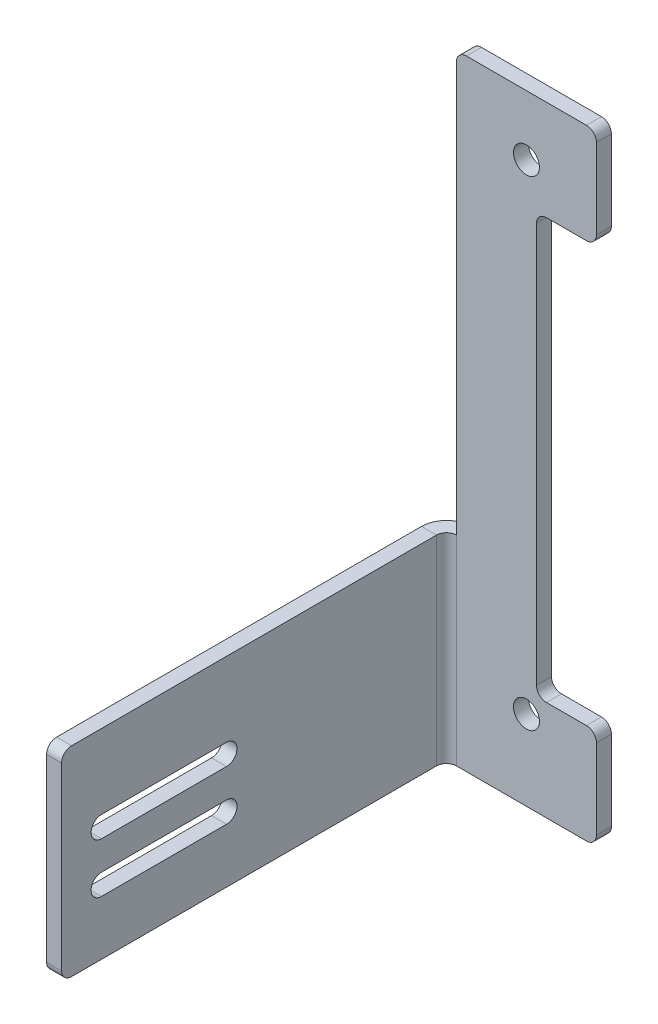
from build123d import *

# Parameters (mm, degrees)
ODGI_CIE_BAZOWE1_DEPTH             = 3
ODGI_CIE_KRAW_DZI1_STRIP_W         = 16
ODGI_CIE_KRAW_DZI1_STRIP_H         = 3
ODGI_CIE_KRAW_DZI1_STRIP_CUT_DEPTH = 124
ODGI_CIE_KRAW_DZI1_DEPTH           = 124
WYTNIJ_WYCI_GNI_CIE1_DEPTH         = 84
OTW_R_5_2_5_2_1_D                  = 5.2
OTW_R_4_2_4_2_1_D                  = 4.2
WYTNIJ_WYCI_GNI_CIE2_DEPTH         = 104.310212467
ZAOKR_GLENIE1_R                    = 2


# Sheet-metal steps are written as plain solids
with BuildPart() as part:
    # Szkic1 → Odgięcie bazowe1 (new body)
    with BuildSketch(Plane.XY):
        Polygon((30, -42), (30, -62), (0, -62), (0, 62), (30, 62), (30, 42), (18, 42), (18, -42), align=None)
    extrude(amount=-ODGI_CIE_BAZOWE1_DEPTH)

    # Odgięcie krawędzi1 strip (across the edge) → Odgięcie krawędzi1 strip cut (cut)
    with BuildSketch(Plane.XZ.offset(-62)):
        with Locations((-6, -1.5)):
            Rectangle(ODGI_CIE_KRAW_DZI1_STRIP_W, ODGI_CIE_KRAW_DZI1_STRIP_H)
    extrude(amount=ODGI_CIE_KRAW_DZI1_STRIP_CUT_DEPTH, mode=Mode.SUBTRACT)

    # Odgięcie krawędzi1 section (across the edge) → Odgięcie krawędzi1 (add)
    with BuildSketch(Plane.XZ.offset(-62)):
        with BuildLine():
            Line((-3, 2), (-3, 77))
            Line((-3, 77), (0, 77))
            Line((0, 77), (0, 2))
            ThreePointArc((0, 2), (0.585786438, 0.585786438), (2, 0))
            Line((2, 0), (2, -3))
            ThreePointArc((2, -3), (-1.535533906, -1.535533906), (-3, 2))
        make_face()
    extrude(amount=ODGI_CIE_KRAW_DZI1_DEPTH)

    # Szkic10 → Wytnij-wyciągnięcie1 (cut)
    with BuildSketch(Plane(origin=(0, 62, 0), x_dir=(1, 0, 0), z_dir=(0, 1, 0))):
        with BuildLine():
            Line((2, 0), (2, 3))
            ThreePointArc((2, 3), (-1.535533906, 1.535533906), (-3, -2))
            Line((-3, -2), (-3, -77))
            Line((-3, -77), (0, -77))
            Line((0, -77), (0, -2))
            ThreePointArc((0, -2), (0.585786438, -0.585786438), (2, 0))
        make_face()
    extrude(amount=-WYTNIJ_WYCI_GNI_CIE1_DEPTH, mode=Mode.SUBTRACT)

    # Otwór Ø5.2 (5.2)1 (through all)
    with Locations(Plane(origin=(16, -46, 0), x_dir=(1, 0, 0), z_dir=(0, 0, 1))):
        with Locations((0, 0), (0, 96)):
            Hole(OTW_R_5_2_5_2_1_D / 2)

    # Otwór Ø4.2 (4.2)1 (through all)
    with Locations(Plane(origin=(0, -49, 69), x_dir=(0, 0, 1), z_dir=(1, 0, 0))):
        with Locations((0, 0), (0, -10)):
            Hole(OTW_R_4_2_4_2_1_D / 2)

    # Szkic14 → Wytnij-wyciągnięcie2 (cut, through all)
    with BuildSketch(Plane(origin=(0, 0, 0), x_dir=(0, 0, -1), z_dir=(1, 0, 0))):
        with BuildLine():
            Line((-69, -46.9), (-44, -46.9))
            ThreePointArc((-44, -46.9), (-41.9, -49), (-44, -51.1))
            Line((-44, -51.1), (-69, -51.1))
            ThreePointArc((-69, -51.1), (-71.1, -49), (-69, -46.9))
        make_face()
        with BuildLine():
            Line((-69, -36.9), (-44, -36.9))
            ThreePointArc((-44, -36.9), (-41.9, -39), (-44, -41.1))
            Line((-44, -41.1), (-69, -41.1))
            ThreePointArc((-69, -41.1), (-71.1, -39), (-69, -36.9))
        make_face()
    extrude(amount=-WYTNIJ_WYCI_GNI_CIE2_DEPTH, mode=Mode.SUBTRACT)

    # Zaokrąglenie1
    zaokr_glenie1_edges = [part.edges().sort_by_distance(p)[0] for p in [
        (30, 62, -1.5),
        (30, 42, -1.5),
        (18, 42, -1.5),
        (18, -42, -1.5),
        (30, -42, -1.5),
        (30, -62, -1.5),
        (2, 62, -1.5),
        (-1.5, -62, 77),
        (-1.5, -22, 77),
    ]]
    fillet(zaokr_glenie1_edges, radius=ZAOKR_GLENIE1_R)


solid = part.part
